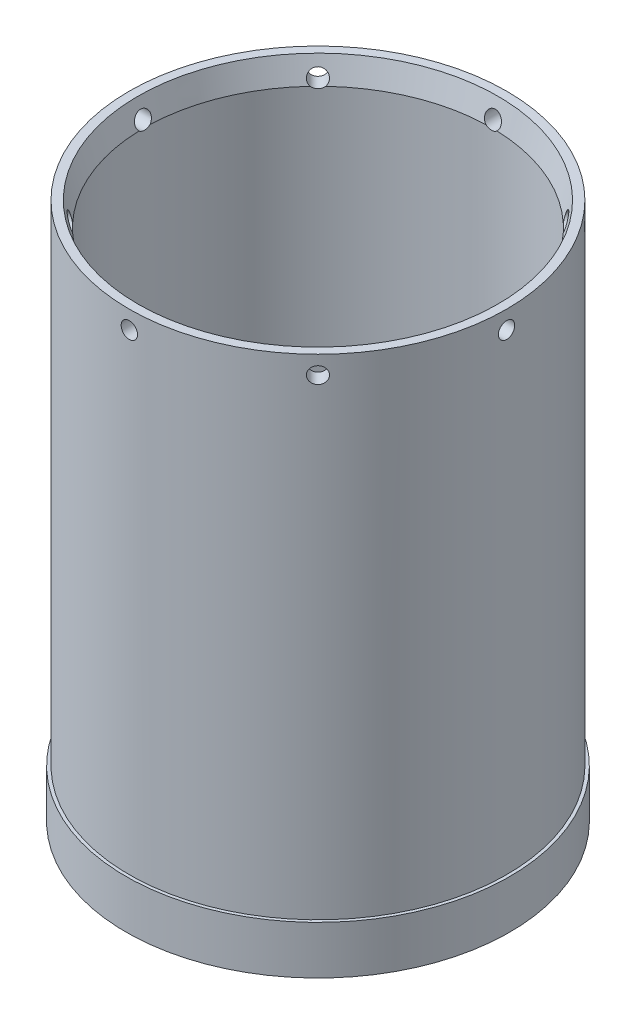
from build123d import *

# Parameters (mm, degrees)
SKETCH1_R           = 49.72
SKETCH1_R_2         = 45.72
BOSS_EXTRUDE1_DEPTH = 139.7
BOSS_EXTRUDE2_START = 2
SKETCH2_R           = 49.72
BOSS_EXTRUDE2_DEPTH = 2
CIRPATTERN1_COUNT   = 8
SKETCH5_R           = 50.546
SKETCH5_R_2         = 49.72
BOSS_EXTRUDE3_DEPTH = 12.7
BOSS_EXTRUDE4_DEPTH = 50.8
CIRPATTERN2_COUNT   = 2
CHAMFER1_SIZE       = 1.701477372
CHAMFER1_SIZE_2     = 6.35


with BuildPart() as part:
    # Sketch1 → Boss-Extrude1 (new body)
    with BuildSketch(Plane(origin=(0, 0, 0), x_dir=(1, 0, 0), z_dir=(0, 1, 0))):
        with Locations(Location((0, 0, 0), (0, 0, 270))):
            Circle(SKETCH1_R)
        with Locations(Location((0, 0, 0), (0, 0, 270))):
            Circle(SKETCH1_R_2, mode=Mode.SUBTRACT)
    extrude(amount=BOSS_EXTRUDE1_DEPTH)

    # Sketch2 → Boss-Extrude2 (add)
    with BuildSketch(Plane.XZ.offset(BOSS_EXTRUDE2_START)):
        with Locations(Location((0, 0, 0), (0, 0, 270))):
            Circle(SKETCH2_R)
    extrude(amount=-BOSS_EXTRUDE2_DEPTH)

    # Sketch4 → #6 Clearance Hole1 (revolve, cut)
    with BuildSketch(Plane(origin=(0, 134.9375, 49.72), x_dir=(0, -1, 0), z_dir=(1, 0, 0))):
        Polygon((0, 0), (0, 26.439442612), (2.15265, 25.146), (2.15265, 0), align=None)
    f_6_clearance_hole1 = revolve(axis=Axis((0, 134.9375, 56.07), (0, 0, -1)), mode=Mode.SUBTRACT)

    # CirPattern1: #6 Clearance Hole1 ×8 about axis
    cirpattern1_axis = Axis((0, 139.7, 0), (0, -1, 0))
    for i in range(1, CIRPATTERN1_COUNT):
        add(f_6_clearance_hole1.rotate(cirpattern1_axis, i * 360 / CIRPATTERN1_COUNT), mode=Mode.SUBTRACT)

    # Sketch5 → Boss-Extrude3 (add)
    with BuildSketch(Plane.XZ.offset(2)):
        with Locations(Location((0, 0, 0), (0, 0, 270))):
            Circle(SKETCH5_R)
        with Locations(Location((0, 0, 0), (0, 0, 270))):
            Circle(SKETCH5_R_2, mode=Mode.SUBTRACT)
    extrude(amount=-BOSS_EXTRUDE3_DEPTH)

    # Sketch6 → Boss-Extrude4 (add)
    with BuildSketch(Plane(origin=(0, 0, 0), x_dir=(1, 0, 0), z_dir=(0, 1, 0))):
        with BuildLine():
            Line((-45.221809329, 6.731), (-38.871809329, 6.731))
            Line((-38.871809329, 6.731), (-38.871809329, 3.556))
            Line((-38.871809329, 3.556), (-45.581501336, 3.556))
            ThreePointArc((-45.581501336, 3.556), (-45.429400867, 5.146643259), (-45.221809329, 6.731))
        make_face()
        with BuildLine():
            Line((-45.581501336, -3.556), (-38.871809329, -3.556))
            Line((-38.871809329, -3.556), (-38.871809329, -6.731))
            Line((-38.871809329, -6.731), (-45.221809329, -6.731))
            ThreePointArc((-45.221809329, -6.731), (-45.429400867, -5.146643259), (-45.581501336, -3.556))
        make_face()
    boss_extrude4 = extrude(amount=BOSS_EXTRUDE4_DEPTH)

    # CirPattern2: Boss-Extrude4 ×2 about axis
    cirpattern2_axis = Axis((0, 0, 0), (0, 1, 0))
    for i in range(1, CIRPATTERN2_COUNT):
        add(boss_extrude4.rotate(cirpattern2_axis, i * 360 / CIRPATTERN2_COUNT))

    # Chamfer1
    # the kernel refuses this chamfer: 6.35, 1.701477372 mm, written as the material it takes off along each edge
    with BuildSketch(Plane(origin=(0, 139.7, 0), x_dir=(0, 0, 1), z_dir=(-1, 0, 0))) as chamfer1_piece_1:
        Polygon((45.72 + CHAMFER1_SIZE, 0), (45.72, -CHAMFER1_SIZE_2), (45.72, 0), align=None)
    revolve(axis=Axis((0, 139.7, 0), (0, 1, 0)), mode=Mode.SUBTRACT)


solid = part.part
